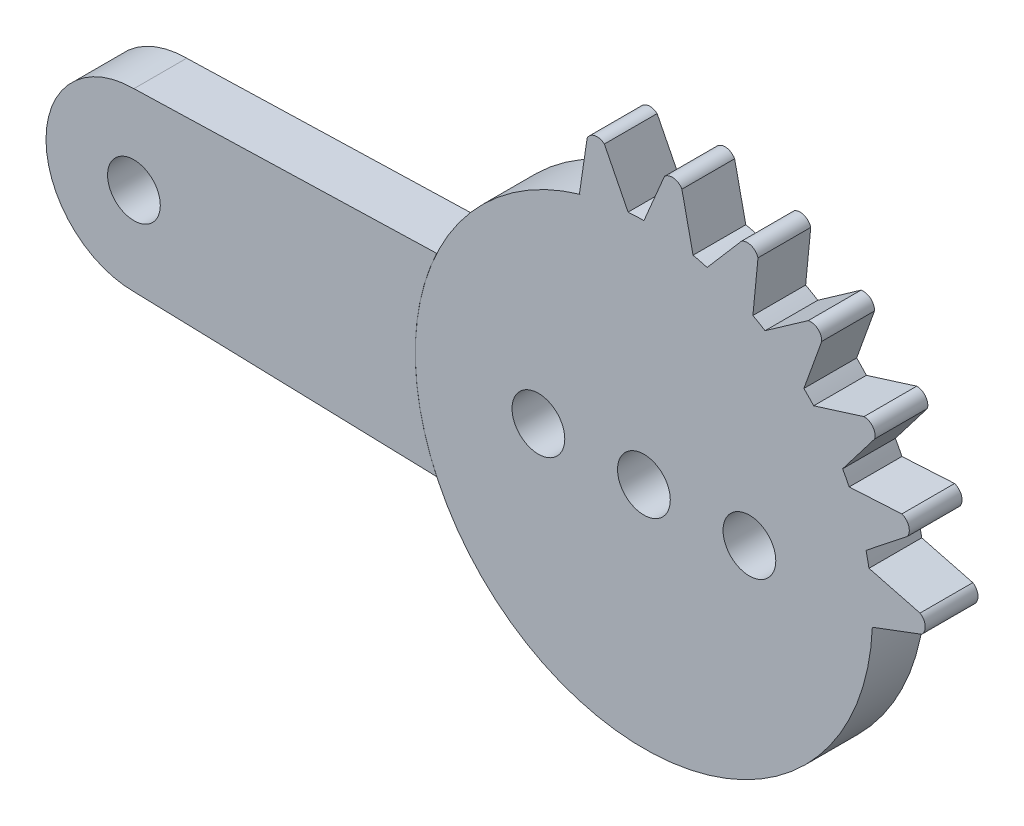
from build123d import *

# Parameters (mm, degrees)
SCHIZZO1_R                   = 13
SCHIZZO1_R_2                 = 1.5
ESTRUSIONE_ESTRUSIONE2_DEPTH = 3
SCHIZZO2_R                   = 1.5
ESTRUSIONE_ESTRUSIONE4_DEPTH = 3
ESTRUSIONE_ESTRUSIONE5_DEPTH = 3


with BuildPart() as part:
    # Schizzo1 → Estrusione-Estrusione2 (new body)
    with BuildSketch(Plane.XY):
        Circle(SCHIZZO1_R)
        with Locations((-6, 0)):
            Circle(SCHIZZO1_R_2, mode=Mode.SUBTRACT)
        with Locations((6, 0)):
            Circle(SCHIZZO1_R_2, mode=Mode.SUBTRACT)
        Circle(SCHIZZO1_R_2, mode=Mode.SUBTRACT)
    extrude(amount=ESTRUSIONE_ESTRUSIONE2_DEPTH)

    # Schizzo3 → Estrusione-Estrusione5 (add)
    with BuildSketch(Plane.XY):
        with BuildLine():
            ThreePointArc((2.160070392, 15.627933395), (1.697201955, 15.940072625), (1.16759145, 15.763463444))
            Line((1.16759145, 15.763463444), (0, 13))
            ThreePointArc((0, 13), (1.40584798, 12.923760732), (2.795206602, 12.695937147))
            Line((2.795206602, 12.695937147), (2.160070392, 15.627933395))
        make_face()
        with BuildLine():
            ThreePointArc((-3.598471304, 12.492037635), (-2.266143189, 12.800960708), (-0.908732869, 12.968199743))
            Line((-0.908732869, 12.968199743), (-0.898912385, 12.969938255))
            Line((-0.898912385, 12.969938255), (-2.248522058, 15.649220571))
            ThreePointArc((-2.248522058, 15.649220571), (-2.78874852, 15.790051886), (-3.229728761, 15.44768583))
            Line((-3.229728761, 15.44768583), (-3.667559269, 12.479807051))
            Line((-3.667559269, 12.479807051), (-3.598471304, 12.492037635))
        make_face()
        with BuildLine():
            Line((5.551256778, 14.767591357), (3.595206602, 12.492977607))
            ThreePointArc((3.595206602, 12.492977607), (4.925139788, 12.030918422), (6.197305427, 11.427747173))
            Line((6.197305427, 11.427747173), (6.488312128, 14.413599664))
            ThreePointArc((6.488312128, 14.413599664), (6.106946442, 14.821322981), (5.551256778, 14.767591357))
        make_face()
        with BuildLine():
            ThreePointArc((12.798690895, 2.278927679), (12.970080361, 0.881484793), (12.989342221, -0.526297133))
            Line((12.989342221, -0.526297133), (15.79780933, 0.528459946))
            ThreePointArc((15.79780933, 0.528459946), (15.995714682, 1.050486345), (15.702570302, 1.525612078))
            Line((15.702570302, 1.525612078), (12.798690895, 2.278927679))
        make_face()
        with BuildLine():
            Line((9.342997115, 12.74984135), (6.888483888, 11.024916768))
            ThreePointArc((6.888483888, 11.024916768), (8.040344195, 10.215325018), (9.097898355, 9.285916515))
            Line((9.097898355, 9.285916515), (10.112874129, 12.109004218))
            ThreePointArc((10.112874129, 12.109004218), (9.885726441, 12.618986587), (9.342997115, 12.74984135))
        make_face()
        with BuildLine():
            Line((12.514244156, 9.60686731), (9.651842013, 8.708728137))
            ThreePointArc((9.651842013, 8.708728137), (10.53701882, 7.613884317), (11.298605688, 6.429736349))
            Line((11.298605688, 6.429736349), (13.122911734, 8.811313022))
            ThreePointArc((13.122911734, 8.811313022), (13.014464163, 9.358960001), (12.514244156, 9.60686731))
        make_face()
        with BuildLine():
            ThreePointArc((11.672700614, 5.722592102), (12.223098799, 4.426720655), (12.630130813, 3.078927679))
            Line((12.630130813, 3.078927679), (14.983183808, 4.939879478))
            ThreePointArc((14.983183808, 4.939879478), (15.059699232, 5.49289257), (14.667987618, 5.890686613))
            Line((14.667987618, 5.890686613), (11.672700614, 5.722592102))
        make_face()
    extrude(amount=ESTRUSIONE_ESTRUSIONE5_DEPTH)


with BuildPart() as body_2:
    # Schizzo2 → Estrusione-Estrusione4 (new body)
    with BuildSketch(Plane.XY):
        with BuildLine():
            Line((-11.784242129, 5.499854155), (-29, 5))
            ThreePointArc((-29, 5), (-34, 0), (-29, -5))
            Line((-29, -5), (-11.784242129, -5.499854155))
            ThreePointArc((-11.784242129, -5.499854155), (-13.004489928, 0), (-11.784242129, 5.499854155))
        make_face()
        with Locations((-29, 0)):
            Circle(SCHIZZO2_R, mode=Mode.SUBTRACT)
    extrude(amount=ESTRUSIONE_ESTRUSIONE4_DEPTH)


solid = Compound([part.part, body_2.part])
